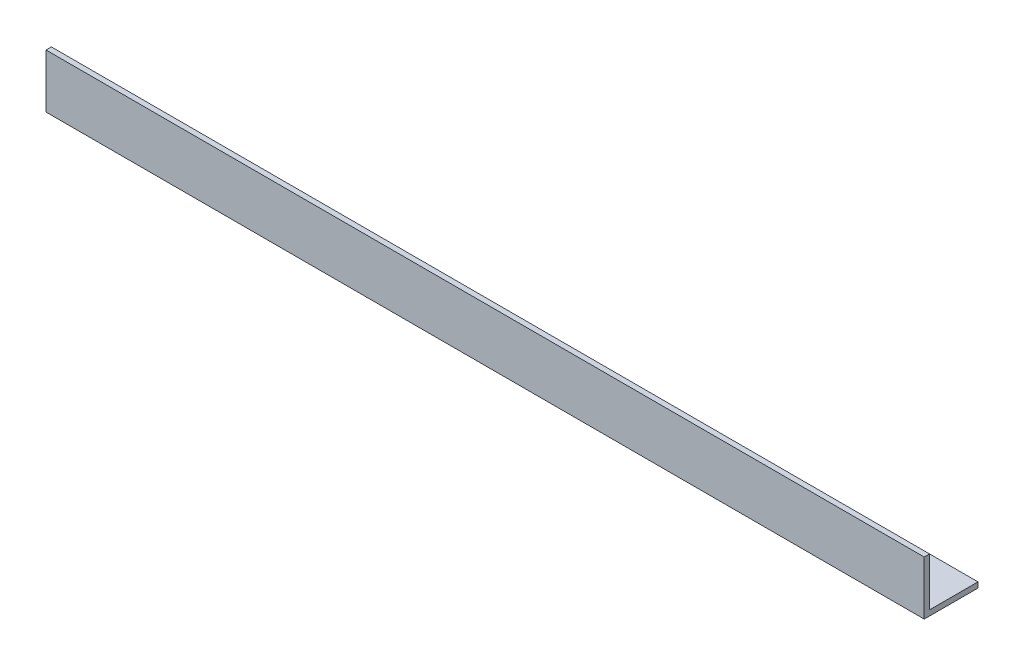
from build123d import *

# Parameters (mm, degrees)
EXTRUDE_1_DEPTH = 490


with BuildPart() as part:
    # Эскиз1 → Вытянуть-Тонкостенный1 (new body)
    with BuildSketch(Plane(origin=(0, 0, 0), x_dir=(0, 0, -1), z_dir=(1, 0, 0))):
        Polygon((0, 30), (0, 0), (30, 0), (30, 3), (3, 3), (3, 30), align=None)
    extrude(amount=EXTRUDE_1_DEPTH)


solid = part.part
